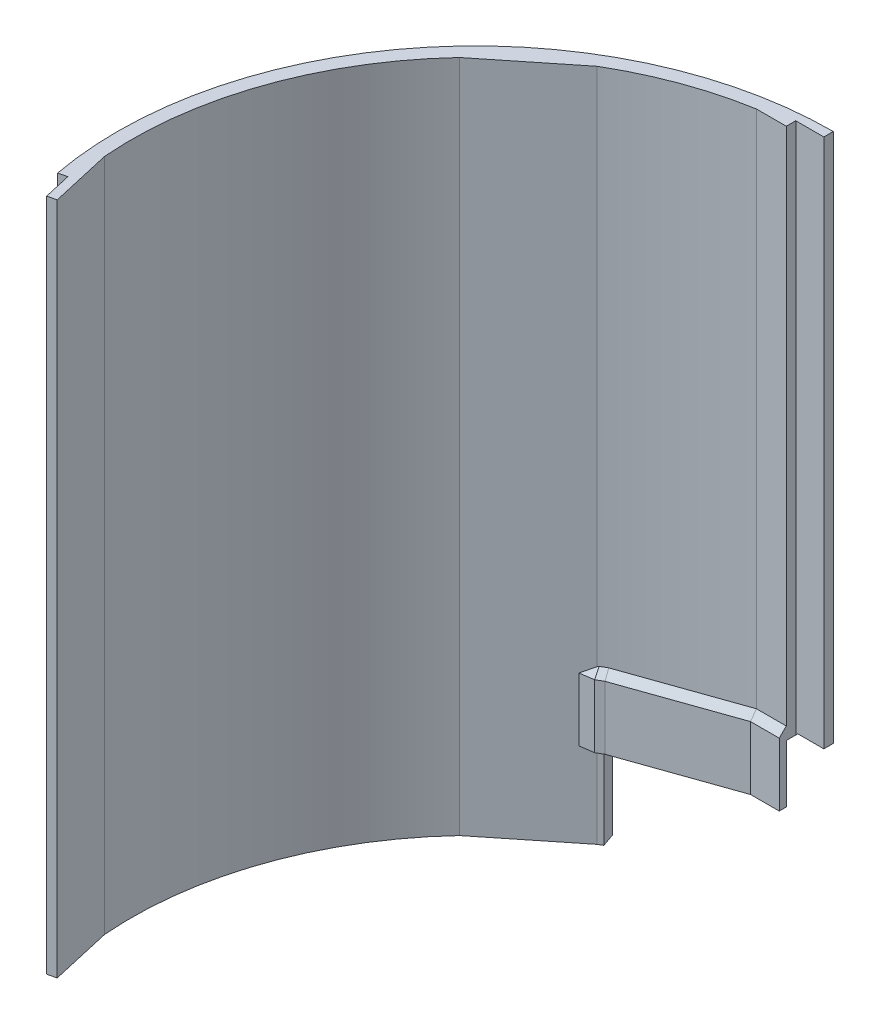
from build123d import *

# Parameters (mm, degrees)
EXTRUDE_1_DEPTH     = 96
CUT_EXTRUDE_1_DEPTH = 115.435602569
CUT_EXTRUDE_2_DEPTH = 125.800902391
EXTRUDE_2_DEPTH     = 10
CHAMFER_1_SIZE      = 1


with BuildPart() as part:
    # Эскиз1 → Бобышка-Вытянуть1 (new body)
    with BuildSketch(Plane(origin=(0, 0, 0), x_dir=(1, 0, 0), z_dir=(0, 1, 0))):
        with BuildLine():
            Line((-46.843090279, -12.726935731), (-48.838961005, -3.96936871))
            ThreePointArc((-48.838961005, -3.96936871), (-46.263287314, 16.146462365), (-35.762915695, 33.496475352))
            Line((-35.762915695, 33.496475352), (-24.862084305, 42.224125379))
            ThreePointArc((-24.862084305, 42.224125379), (-24.343954807, 42.524955783), (-23.822185811, 42.819428571))
            ThreePointArc((-23.822185811, 42.819428571), (-16.269960049, 46.22), (-8.252878286, 48.3))
            Line((-8.252878286, 48.3), (-4, 48.3))
            Line((-4, 48.3), (-4, 49.65))
            Line((-4, 49.65), (0, 49.65))
            Line((0, 49.65), (0, 51))
            ThreePointArc((0, 51), (-39.236846594, 32.580206711), (-50.131159715, -9.373730613))
            Line((-50.131159715, -9.373730613), (-48.950659721, -9.104691807))
            Line((-48.950659721, -9.104691807), (-48.061840279, -13.004691807))
            Line((-48.061840279, -13.004691807), (-46.843090279, -12.726935731))
        make_face()
    extrude(amount=EXTRUDE_1_DEPTH)

    # Эскиз2 → Вырез-Вытянуть1 (cut, through all)
    with BuildSketch(Plane(origin=(-12.717132038, 0, -36.127061224), x_dir=(0.9432653061224487, 0, -0.33204000100247416), z_dir=(0.33204000100247416, 0, 0.9432653061224487))):
        Polygon((8.752878286, 0), (8.752878286, 17.5), (-5.459985067, 17.5), (-8.752878286, 14.207106781), (-8.752878286, 0), (-8.252878286, 0), (8.252878286, 0), align=None)
    extrude(amount=-CUT_EXTRUDE_1_DEPTH, mode=Mode.SUBTRACT)

    # Эскиз3 → Вырез-Вытянуть2 (cut, through all)
    with BuildSketch(Plane.XY.offset(-48.3)):
        Polygon((-3.5, 20), (0, 20), (0, 20.5), (-3.707106781, 20.5), (-6.707106781, 17.5), (-8.752878286, 17.5), (-8.752878286, 0), (-8.252878286, 0), (-8.252878286, 17), (-6.5, 17), align=None)
        Polygon((0, 0), (0, 20), (-3.5, 20), (-6.5, 17), (-8.252878286, 17), (-8.252878286, 0), align=None)
    extrude(amount=-CUT_EXTRUDE_2_DEPTH, mode=Mode.SUBTRACT)

    # Эскиз4 → Бобышка-Вытянуть2 (add)
    with BuildSketch(Plane(origin=(0, 12, 0), x_dir=(1, 0, 0), z_dir=(0, 1, 0))):
        with BuildLine():
            Line((-20.660349892, 42.872283268), (-8.082011241, 47.3))
            Line((-8.082011241, 47.3), (-4, 47.3))
            Line((-4, 47.3), (-4, 48.3))
            Line((-4, 48.3), (-8.252878286, 48.3))
            Line((-8.252878286, 48.3), (-20.992389893, 43.815548574))
            Line((-20.992389893, 43.815548574), (-23.822185811, 42.819428571))
            ThreePointArc((-23.822185811, 42.819428571), (-24.343954807, 42.524955783), (-24.862084305, 42.224125379))
            Line((-24.862084305, 42.224125379), (-26.311602254, 41.063582213))
            Line((-26.311602254, 41.063582213), (-24.354694829, 41.362408534))
            ThreePointArc((-24.354694829, 41.362408534), (-23.883747135, 41.636121611), (-23.409723676, 41.904472761))
            Line((-23.409723676, 41.904472761), (-20.660349892, 42.872283268))
        make_face()
    extrude(amount=EXTRUDE_2_DEPTH)

    # Фаска1
    chamfer_1_edges = [part.edges().sort_by_distance(p)[0] for p in [
        (-25.333148542, 22, -41.212995374),
        (-23.883747135, 22, -41.636121611),
        (-15.745867458, 22, -44.602236381),
        (-6.04100562, 22, -47.3),
    ]]
    chamfer(chamfer_1_edges, length=CHAMFER_1_SIZE - 0.0001)  # a hair under: the kernel refuses the full size


solid = part.part
